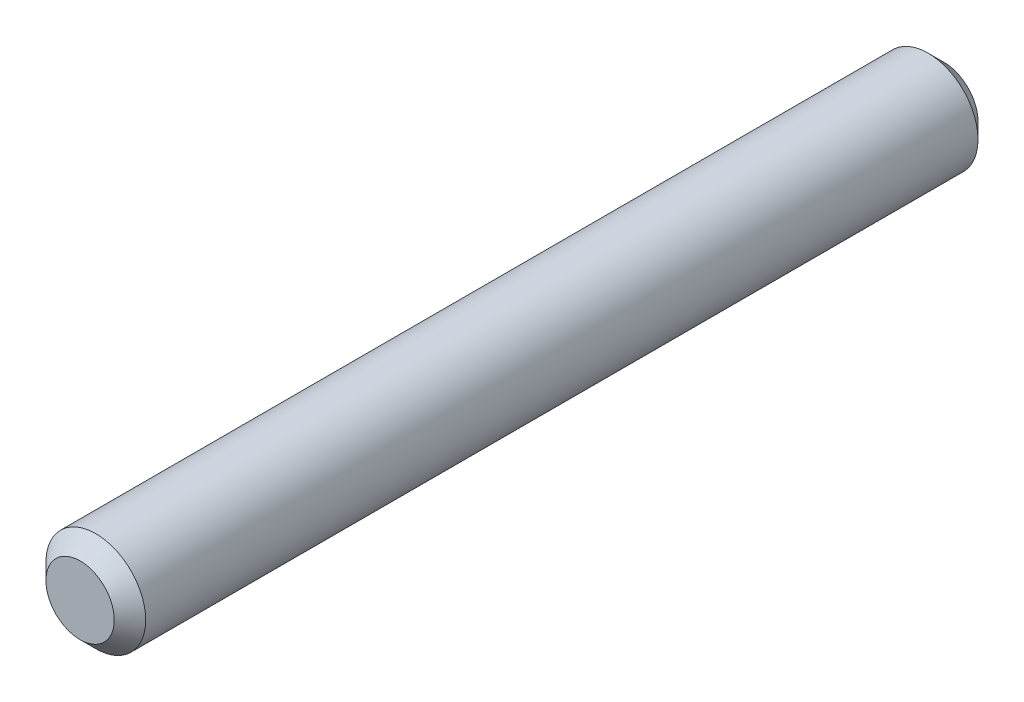
from build123d import *

# Parameters (mm, degrees)
SKETCH1_R           = 3.175
BOSS_EXTRUDE1_DEPTH = 55
CHAMFER1_SIZE       = 1


with BuildPart() as part:
    # Sketch1 → Boss-Extrude1 (new body)
    with BuildSketch(Plane.XY):
        Circle(SKETCH1_R)
    extrude(amount=-BOSS_EXTRUDE1_DEPTH)

    # Chamfer1
    chamfer1_edges = [part.edges().sort_by_distance(p)[0] for p in [
        (-3.175, 0, -55),
        (-3.175, 0, 0),
    ]]
    chamfer(chamfer1_edges, length=CHAMFER1_SIZE)


solid = part.part
